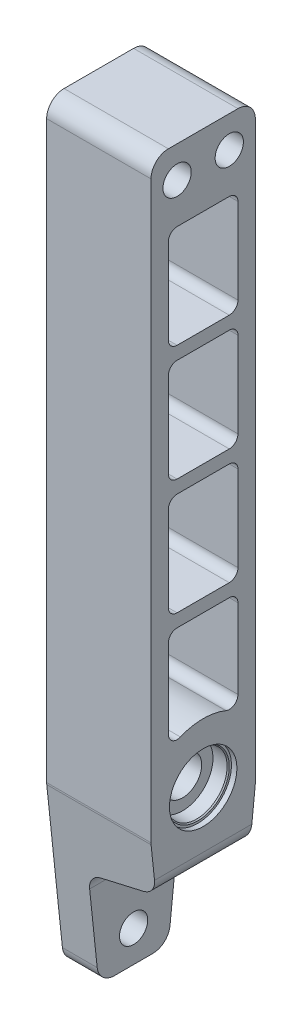
from build123d import *

# Parameters (mm, degrees)
SKETCH5_W               = 38.1
SKETCH5_H               = 298.45
BOSS_EXTRUDE2_DEPTH     = 19.05
F_3_8_CLEARANCE_HOLE2_D = 10.31748
F_3_8_CLEARANCE_HOLE4_D = 13.97
BODY_MOVE_COPY4_ANGLE   = 90
F_3_8_CLEARANCE_HOLE3_D = 10.31748
CUT_EXTRUDE1_DEPTH      = 218.574389578
CUT_EXTRUDE1_DEPTH_BACK = 218.574389578
CUT_EXTRUDE2_DEPTH      = 218.574389578
CUT_EXTRUDE2_DEPTH_BACK = 218.574389578
SKETCH12_W              = 25.4
SKETCH12_H              = 37.531383446
SKETCH12_H_2            = 37.531383447
CUT_EXTRUDE3_DEPTH      = 218.574389578
CUT_EXTRUDE3_DEPTH_BACK = 218.574389578
CUT_EXTRUDE5_DEPTH      = 211.093240097
CUT_EXTRUDE5_DEPTH_BACK = 211.093240097
FILLET1_R               = 3.175
FILLET2_R               = 6.35
FILLET3_R               = 6.35


with BuildPart() as part:
    # Sketch5 → Boss-Extrude2 (new, symmetric)
    with BuildSketch(Plane.XY):
        with Locations((0, 66.675)):
            Rectangle(SKETCH5_W, SKETCH5_H)
    extrude(amount=BOSS_EXTRUDE2_DEPTH, both=True)

    # 3/8 Clearance Hole2 (through all)
    with Locations(Plane(origin=(19.05, 0, 0), x_dir=(0, 0, -1), z_dir=(1, 0, 0))):
        with Locations((0, -57.15)):
            Hole(F_3_8_CLEARANCE_HOLE2_D / 2)

    # 3/8 Clearance Hole4 (through all)
    with Locations(Plane(origin=(19.05, 0, 0), x_dir=(0, 0, -1), z_dir=(1, 0, 0))):
        with Locations((0, 0)):
            Hole(F_3_8_CLEARANCE_HOLE4_D / 2)


with BuildPart() as body_2:
    # uxcell-FR6ZZ: read off the stored shape, not the designer's step
    # uxcell-FR6ZZ outline → uxcell-FR6ZZ (revolve)
    with BuildSketch(Plane(origin=(46.870492888, 0, -67.456601715), x_dir=(1, 0, 0), z_dir=(0, 0, 1))):
        Polygon((12.303125, 146.229545606), (4.7625, 146.229545606), (4.7625, 138.704795606), (11.1125, 138.704795606), (11.1125, 143.864170606), (11.509375, 144.261045606), (12.303125, 144.261045606), align=None)
    revolve(axis=Axis((46.870492888, 0, -67.456601715), (0, 1, 0)))


with BuildPart() as body_2_1:
    # Body-Move/Copy4: read off the stored shape, not the designer's step
    # Body-Move/Copy4: moved
    add(body_2.part.moved(Location((-46.8704929, -127.1795456, 67.4566017))).rotate(Axis((0, 0, 0), (0, 0, -1)), BODY_MOVE_COPY4_ANGLE))


with BuildPart() as body_3:
    # Mirror1: mirrored copy
    add(body_2_1.part.mirror(Plane(origin=(0, 0, 0), x_dir=(0, 0, 1), z_dir=(1, 0, 0))))


with BuildPart() as part_1:
    add(part.part)

    # Combine2: cut body 3, body 2
    add(body_3.part, mode=Mode.SUBTRACT)
    add(body_2_1.part, mode=Mode.SUBTRACT)

    # 3/8 Clearance Hole3 (through all)
    with Locations(Plane(origin=(19.05, 0, 0), x_dir=(0, 0, -1), z_dir=(1, 0, 0))):
        with Locations((-9.525, 196.85), (9.525, 196.85)):
            Hole(F_3_8_CLEARANCE_HOLE3_D / 2)

    # Sketch11 → Cut-Extrude1 (cut, two sides: drawn at the far end of the back side and taken through both)
    with BuildSketch(Plane.XY.offset(-CUT_EXTRUDE1_DEPTH_BACK)):
        Polygon((-6.35, -691.607801887), (-6.35, -82.55), (-6.35, -31.75), (19.05, -25.4), (609.922858655, 122.318214664), (1581.067185153, -612.994182394), (964.794326498, -1426.920198945), align=None)
    extrude(amount=CUT_EXTRUDE1_DEPTH + CUT_EXTRUDE1_DEPTH_BACK, mode=Mode.SUBTRACT)

    # Sketch12 → Cut-Extrude2 (cut, two sides: drawn at the far end of the back side and taken through both)
    with BuildSketch(Plane(origin=(0, 0, 0), x_dir=(0, 0, -1), z_dir=(1, 0, 0)).offset(-CUT_EXTRUDE2_DEPTH_BACK)):
        with Locations((0, 163.400568277)):
            Rectangle(SKETCH12_W, SKETCH12_H)
        with Locations((0, 121.106684831)):
            Rectangle(SKETCH12_W, SKETCH12_H_2)
        with Locations((0, 78.812801384)):
            Rectangle(SKETCH12_W, SKETCH12_H)
        with BuildLine():
            Line((12.7, 17.753226214), (12.7, 55.284609661))
            Line((12.7, 55.284609661), (-12.7, 55.284609661))
            Line((-12.7, 55.284609661), (-12.7, 17.753226214))
            ThreePointArc((-12.7, 17.753226214), (0, 21.828125), (12.7, 17.753226214))
        make_face()
    extrude(amount=CUT_EXTRUDE2_DEPTH + CUT_EXTRUDE2_DEPTH_BACK, mode=Mode.SUBTRACT)

    # Sketch16 → Cut-Extrude3 (cut, two sides: drawn at the far end of the back side and taken through both)
    with BuildSketch(Plane(origin=(0, 0, 0), x_dir=(0, 0, -1), z_dir=(1, 0, 0)).offset(-CUT_EXTRUDE3_DEPTH_BACK)):
        Polygon((-615.836179143, 208.35874), (-19.05, 208.35874), (19.05, 208.35874), (615.836179143, 208.35874), (615.836179143, 1401.931098287), (-615.836179143, 1401.931098287), align=None)
    extrude(amount=CUT_EXTRUDE3_DEPTH + CUT_EXTRUDE3_DEPTH_BACK, mode=Mode.SUBTRACT)

    # Sketch18 → Cut-Extrude5 (cut, two sides: drawn at the far end of the back side and taken through both)
    with BuildSketch(Plane(origin=(0, 0, 0), x_dir=(0, 0, -1), z_dir=(1, 0, 0)).offset(-CUT_EXTRUDE5_DEPTH_BACK)):
        Polygon((-66.072467933, 439.146371732), (-19.05, -8.242525716), (-12.7, -68.65874), (12.7, -68.65874), (19.05, -8.242525716), (66.072467933, 439.146371732), (66.072467933, -460.560109405), (-66.072467933, -460.560109405), align=None)
    extrude(amount=CUT_EXTRUDE5_DEPTH + CUT_EXTRUDE5_DEPTH_BACK, mode=Mode.SUBTRACT)

    # Fillet1
    fillet1_edges = [part_1.edges().sort_by_distance(p)[0] for p in [
        (0, 60.047109661, -12.7),
        (0, 60.047109661, 12.7),
        (0, 55.284609661, 12.7),
        (0, 55.284609661, -12.7),
        (0, 17.753226214, -12.7),
        (0, 17.753226214, 12.7),
        (0, 182.16626, -12.7),
        (0, 144.634876554, -12.7),
        (0, 144.634876554, 12.7),
        (0, 182.16626, 12.7),
        (0, 139.872376554, 12.7),
        (0, 139.872376554, -12.7),
        (0, 102.340993107, -12.7),
        (0, 102.340993107, 12.7),
        (0, 97.578493107, 12.7),
        (0, 97.578493107, -12.7),
    ]]
    fillet(fillet1_edges, radius=FILLET1_R)

    # Fillet2
    fillet2_edges = [part_1.edges().sort_by_distance(p)[0] for p in [
        (0, 208.35874, -19.05),
        (0, 208.35874, 19.05),
        (0, -8.242525716, 19.05),
        (-12.7, -68.65874, 12.7),
        (-12.7, -68.65874, -12.7),
        (0, -8.242525716, -19.05),
    ]]
    fillet(fillet2_edges, radius=FILLET2_R)

    # Fillet3
    fillet3_edges = [part_1.edges().sort_by_distance(p)[0] for p in [
        (-6.35, -31.75, 0),
        (19.05, -25.4, 0),
    ]]
    fillet(fillet3_edges, radius=FILLET3_R)


solid = part_1.part
